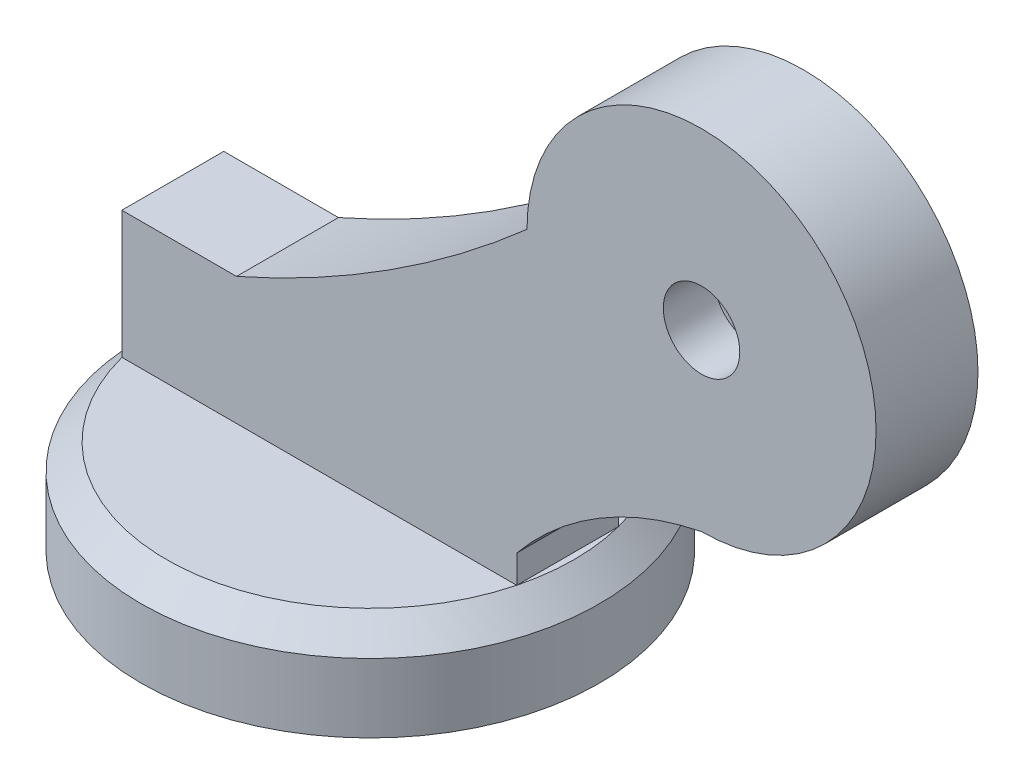
from build123d import *

# Parameters (mm, degrees)
SKETCH3_R                = 90
BOSS_EXTRUDE1_DEPTH      = 37
CHAMFER1_SIZE            = 10
SKETCH4_W                = 155
SKETCH4_H                = 40
BOSS_EXTRUDE2_DEPTH      = 50
CUT_EXTRUDE1_DEPTH       = 167.640331253
BOSS_EXTRUDE4_DEPTH      = 20
BOSS_EXTRUDE5_DEPTH      = 3.75
BOSS_EXTRUDE5_DRAFT      = 70
SKETCH8_R                = 40
BOSS_EXTRUDE6_DEPTH      = 1.5
BOSS_EXTRUDE8_START      = 3
SKETCH9_R                = 40
BOSS_EXTRUDE8_DEPTH      = 3
SKETCH14_R               = 40
BOSS_EXTRUDE9_DEPTH      = 18
BOSS_EXTRUDE9_TAPER      = 28
CUT_EXTRUDE4_REACH       = 346.265
SKETCH16_R               = 1.5
CUT_EXTRUDE5_DEPTH       = 5
CIRPATTERN1_COUNT        = 12
SKETCH17_R               = 22.5
CUT_EXTRUDE6_DEPTH       = 2
CUT_EXTRUDE6_DRAFT       = -45
BOSS_EXTRUDE10_DEPTH     = 4
BOSS_EXTRUDE10_DRAFT     = 20
CIRPATTERN2_COPY_1_DEPTH = 4
CIRPATTERN2_COPY_1_DRAFT = 20
CIRPATTERN2_COPY_2_DEPTH = 4
CIRPATTERN2_COPY_2_DRAFT = 20
CIRPATTERN2_COPY_3_DEPTH = 4
CIRPATTERN2_COPY_3_DRAFT = 20
SKETCH19_R               = 10.046864526
BOSS_EXTRUDE11_DEPTH     = 4
SKETCH20_R               = 5
CUT_EXTRUDE7_DEPTH       = 4
SKETCH21_R               = 15
CUT_EXTRUDE8_DEPTH       = 20
SKETCH22_R               = 15
CUT_EXTRUDE9_DEPTH       = 20


# Read off the part's stored shape, not the designer's step: Boss-Extrude5
with BuildPart() as part:
    # Sketch3 → Boss-Extrude1 (new body)
    with BuildSketch(Plane(origin=(0, 0, 0), x_dir=(1, 0, 0), z_dir=(0, 1, 0))):
        with Locations(Location((0, 0, 0), (0, 0, 270))):
            Circle(SKETCH3_R)
    extrude(amount=BOSS_EXTRUDE1_DEPTH)

    # Chamfer1
    chamfer1_edges = [part.edges().sort_by_distance(p)[0] for p in [
        (0, 37, -90),
    ]]
    chamfer(chamfer1_edges, length=CHAMFER1_SIZE)

    # Sketch4 → Boss-Extrude2 (add)
    with BuildSketch(Plane(origin=(0, 37, 0), x_dir=(1, 0, 0), z_dir=(0, 1, 0))):
        Rectangle(SKETCH4_W, SKETCH4_H)
    extrude(amount=BOSS_EXTRUDE2_DEPTH)

    # Sketch5 → Cut-Extrude1 (cut, through all)
    with BuildSketch(Plane(origin=(0, 0, -20), x_dir=(-1, 0, 0), z_dir=(0, 0, -1))):
        with BuildLine():
            Line((-77.5, 87), (32.5, 87))
            ThreePointArc((32.5, 87), (-18.551432041, 56.363013449), (-77.5, 48))
            Line((-77.5, 48), (-77.5, 87))
        make_face()
    extrude(amount=-CUT_EXTRUDE1_DEPTH, mode=Mode.SUBTRACT)


with BuildPart() as body_2:
    # Sketch6 → Boss-Extrude4 (new, symmetric)
    with BuildSketch(Plane.XY):
        with BuildLine():
            ThreePointArc((150, 91.5), (198.436814511, 208.436814511), (81.5, 160))
            ThreePointArc((81.5, 160), (27.32419397, 119.089614896), (-32.5, 87))
            ThreePointArc((-32.5, 87), (18.551432041, 56.363013449), (77.5, 48))
            ThreePointArc((77.5, 48), (109.960480223, 76.065866296), (150, 91.5))
        make_face()
    extrude(amount=BOSS_EXTRUDE4_DEPTH, both=True)


with BuildPart() as boss_extrude5_tool:
    # Boss-Extrude5 outline → Boss-Extrude5 (with draft: the straight prism first)
    with BuildSketch(Plane(origin=(0, 0, -23.75), x_dir=(-1, 0, 0), z_dir=(0, 0, -1))):
        with BuildLine():
            ThreePointArc((-72.55176842, 58.097049986), (-27.477837166, 64.25636131), (13.227009177, 84.57167275))
            ThreePointArc((13.227009177, 84.57167275), (-41.886113197, 116.333104692), (-91.973920822, 155.543515864))
            ThreePointArc((-91.973920822, 155.543515864), (-189.891312642, 202.374158297), (-149.050997815, 101.810778399))
            ThreePointArc((-149.050997815, 101.810778399), (-107.143478262, 86.355264818), (-72.55176842, 58.097049986))
        make_face()
    extrude(amount=-BOSS_EXTRUDE5_DEPTH)
    # Boss-Extrude5: the draft: its side faces are tilted about the plane it starts from
    boss_extrude5_sides = [boss_extrude5_tool.faces().sort_by_distance(p)[0] for p in [
        (189.891312643, 202.374158296, -21.875),
        (107.143478261, 86.355264818, -21.875),
        (27.477837166, 64.25636131, -21.875),
        (41.886113197, 116.333104692, -21.875),
    ]]
    draft(boss_extrude5_sides, Plane(origin=(0, 0, -23.75), x_dir=(-1, 0, 0), z_dir=(0, 0, -1)), BOSS_EXTRUDE5_DRAFT)


with BuildPart() as part_1:
    add(part.part)

    # Boss-Extrude5: add boss_extrude5_tool
    add(boss_extrude5_tool.part)

    add(body_2.part)  # Boss-Extrude5 merges body 2

    # Sketch8 → Boss-Extrude6 (add, symmetric)
    with BuildSketch(Plane(origin=(0, 0, -23.75), x_dir=(-1, 0, 0), z_dir=(0, 0, -1))):
        with Locations((-150, 160)):
            Circle(SKETCH8_R)
    extrude(amount=BOSS_EXTRUDE6_DEPTH, both=True)

    # Sketch9 → Boss-Extrude8 (add)
    with BuildSketch(Plane(origin=(0, 0, -25.25), x_dir=(-1, 0, 0), z_dir=(0, 0, -1)).offset(BOSS_EXTRUDE8_START)):
        with Locations((-150, 160)):
            Circle(SKETCH9_R)
    extrude(amount=-BOSS_EXTRUDE8_DEPTH)

    # Sketch14 → Boss-Extrude9 (add)
    with BuildSketch(Plane(origin=(0, 0, -28.25), x_dir=(-1, 0, 0), z_dir=(0, 0, -1))):
        with Locations((-150, 160)):
            Circle(SKETCH14_R)
    extrude(amount=BOSS_EXTRUDE9_DEPTH, taper=BOSS_EXTRUDE9_TAPER)

    # Cut-Extrude4: up to this face of the body (flat: up to its plane)
    cut_extrude4_end = Plane(part_1.part.faces().sort_by_distance((104.051669306, 126.132255553, -23.75))[0])
    # Sketch15 → Cut-Extrude4 (cut, up to the picked face)
    with BuildSketch(Plane(origin=(0, 0, -46.25), x_dir=(-1, 0, 0), z_dir=(0, 0, -1)), mode=Mode.PRIVATE) as cut_extrude4_sk1:
        with BuildLine():
            ThreePointArc((-147.878648769, 199.943708753), (-150, 200), (-152.121351231, 199.943708753))
            ThreePointArc((-152.121351231, 199.943708753), (-152.070318455, 194.961359195), (-150, 190.42923023))
            ThreePointArc((-150, 190.42923023), (-147.929681545, 194.961359195), (-147.878648769, 199.943708753))
        make_face()
    cut_extrude4_tool1 = split(extrude(cut_extrude4_sk1.sketch, amount=-CUT_EXTRUDE4_REACH, mode=Mode.PRIVATE), bisect_by=cut_extrude4_end, keep=Keep.BOTH, mode=Mode.PRIVATE)
    cut_extrude4 = cut_extrude4_tool1.solids().sort_by(Axis((150, 196.116659, -46.25), (0, 0, 1)))[0]
    add(cut_extrude4, mode=Mode.SUBTRACT)

    # Sketch16 → Cut-Extrude5 (cut)
    with BuildSketch(Plane(origin=(0, 0, -23.75), x_dir=(-1, 0, 0), z_dir=(0, 0, -1))):
        with Locations((-150, 195.186469492)):
            Circle(SKETCH16_R)
    cut_extrude5 = extrude(amount=-CUT_EXTRUDE5_DEPTH, mode=Mode.SUBTRACT)

    # CirPattern1: Cut-Extrude4, Cut-Extrude5 ×12 about axis
    cirpattern1_axis = Axis((150, 160, 0), (0, 0, 1))
    add([cut_extrude4.rotate(cirpattern1_axis, i * 360 / CIRPATTERN1_COUNT) for i in range(1, CIRPATTERN1_COUNT)], mode=Mode.SUBTRACT)
    add([cut_extrude5.rotate(cirpattern1_axis, i * 360 / CIRPATTERN1_COUNT) for i in range(1, CIRPATTERN1_COUNT)], mode=Mode.SUBTRACT)


with BuildPart() as cut_extrude6_tool:
    # Sketch17 → Cut-Extrude6 (with draft: the straight prism first)
    with BuildSketch(Plane(origin=(0, 0, -46.25), x_dir=(-1, 0, 0), z_dir=(0, 0, -1))):
        with Locations((-150, 160)):
            Circle(SKETCH17_R)
    extrude(amount=-CUT_EXTRUDE6_DEPTH)
    # Cut-Extrude6: the draft: its side faces are tilted about the plane it starts from
    cut_extrude6_sides = [cut_extrude6_tool.faces().sort_by_distance(p)[0] for p in [
        (172.5, 160, -45.25),
    ]]
    draft(cut_extrude6_sides, Plane(origin=(0, 0, -46.25), x_dir=(-1, 0, 0), z_dir=(0, 0, -1)), CUT_EXTRUDE6_DRAFT)


with BuildPart() as part_2:
    add(part_1.part)

    # Cut-Extrude6: cut by cut_extrude6_tool
    add(cut_extrude6_tool.part, mode=Mode.SUBTRACT)


with BuildPart() as boss_extrude10_tool:
    # Sketch18 → Boss-Extrude10 (with draft: the straight prism first)
    with BuildSketch(Plane(origin=(0, 0, -44.25), x_dir=(-1, 0, 0), z_dir=(0, 0, -1))):
        with BuildLine():
            ThreePointArc((-153, 167.95298686), (-150, 168.5), (-147, 167.95298686))
            Line((-147, 167.95298686), (-142.878841571, 178.153211909))
            ThreePointArc((-142.878841571, 178.153211909), (-150, 179.5), (-157.121158429, 178.153211909))
            Line((-157.121158429, 178.153211909), (-153, 167.95298686))
        make_face()
    extrude(amount=BOSS_EXTRUDE10_DEPTH)
    # Boss-Extrude10: the draft: its side faces are tilted about the plane it starts from
    boss_extrude10_sides = [boss_extrude10_tool.faces().sort_by_distance(p)[0] for p in [
        (150, 168.5, -46.25),
        (144.939420785, 173.053099385, -46.25),
        (150, 179.5, -46.25),
        (155.060579215, 173.053099385, -46.25),
    ]]
    draft(boss_extrude10_sides, Plane(origin=(0, 0, -44.25), x_dir=(-1, 0, 0), z_dir=(0, 0, -1)), BOSS_EXTRUDE10_DRAFT)


with BuildPart() as part_3:
    add(part_2.part)

    # Boss-Extrude10: add boss_extrude10_tool
    add(boss_extrude10_tool.part)


with BuildPart() as cirpattern2_copy_1_tool:
    # CirPattern2 copy 1 sketch → CirPattern2 copy 1 (with draft: the straight prism first)
    with BuildSketch(Plane(origin=(310, 10, -44.25), x_dir=(0, -1, 0), z_dir=(0, 0, -1))):
        with BuildLine():
            ThreePointArc((-153, 167.95298686), (-150, 168.5), (-147, 167.95298686))
            Line((-147, 167.95298686), (-142.878841571, 178.153211909))
            ThreePointArc((-142.878841571, 178.153211909), (-150, 179.5), (-157.121158429, 178.153211909))
            Line((-157.121158429, 178.153211909), (-153, 167.95298686))
        make_face()
    extrude(amount=CIRPATTERN2_COPY_1_DEPTH)
    # CirPattern2 copy 1: the draft: its side faces are tilted about the plane it starts from
    cirpattern2_copy_1_sides = [cirpattern2_copy_1_tool.faces().sort_by_distance(p)[0] for p in [
        (141.5, 160, -46.25),
        (136.946900615, 154.939420785, -46.25),
        (130.5, 160, -46.25),
        (136.946900615, 165.060579215, -46.25),
    ]]
    draft(cirpattern2_copy_1_sides, Plane(origin=(310, 10, -44.25), x_dir=(0, -1, 0), z_dir=(0, 0, -1)), CIRPATTERN2_COPY_1_DRAFT)


with BuildPart() as part_4:
    add(part_3.part)

    # CirPattern2 copy 1: add cirpattern2_copy_1_tool
    add(cirpattern2_copy_1_tool.part)


with BuildPart() as cirpattern2_copy_2_tool:
    # CirPattern2 copy 2 sketch → CirPattern2 copy 2 (with draft: the straight prism first)
    with BuildSketch(Plane(origin=(300, 320, -44.25), x_dir=(1, 0, 0), z_dir=(0, 0, -1))):
        with BuildLine():
            ThreePointArc((-153, 167.95298686), (-150, 168.5), (-147, 167.95298686))
            Line((-147, 167.95298686), (-142.878841571, 178.153211909))
            ThreePointArc((-142.878841571, 178.153211909), (-150, 179.5), (-157.121158429, 178.153211909))
            Line((-157.121158429, 178.153211909), (-153, 167.95298686))
        make_face()
    extrude(amount=CIRPATTERN2_COPY_2_DEPTH)
    # CirPattern2 copy 2: the draft: its side faces are tilted about the plane it starts from
    cirpattern2_copy_2_sides = [cirpattern2_copy_2_tool.faces().sort_by_distance(p)[0] for p in [
        (150, 151.5, -46.25),
        (155.060579215, 146.946900615, -46.25),
        (150, 140.5, -46.25),
        (144.939420785, 146.946900615, -46.25),
    ]]
    draft(cirpattern2_copy_2_sides, Plane(origin=(300, 320, -44.25), x_dir=(1, 0, 0), z_dir=(0, 0, -1)), CIRPATTERN2_COPY_2_DRAFT)


with BuildPart() as part_5:
    add(part_4.part)

    # CirPattern2 copy 2: add cirpattern2_copy_2_tool
    add(cirpattern2_copy_2_tool.part)


with BuildPart() as cirpattern2_copy_3_tool:
    # CirPattern2 copy 3 sketch → CirPattern2 copy 3 (with draft: the straight prism first)
    with BuildSketch(Plane(origin=(-10, 310, -44.25), x_dir=(0, 1, 0), z_dir=(0, 0, -1))):
        with BuildLine():
            ThreePointArc((-153, 167.95298686), (-150, 168.5), (-147, 167.95298686))
            Line((-147, 167.95298686), (-142.878841571, 178.153211909))
            ThreePointArc((-142.878841571, 178.153211909), (-150, 179.5), (-157.121158429, 178.153211909))
            Line((-157.121158429, 178.153211909), (-153, 167.95298686))
        make_face()
    extrude(amount=CIRPATTERN2_COPY_3_DEPTH)
    # CirPattern2 copy 3: the draft: its side faces are tilted about the plane it starts from
    cirpattern2_copy_3_sides = [cirpattern2_copy_3_tool.faces().sort_by_distance(p)[0] for p in [
        (158.5, 160, -46.25),
        (163.053099385, 165.060579215, -46.25),
        (169.5, 160, -46.25),
        (163.053099385, 154.939420785, -46.25),
    ]]
    draft(cirpattern2_copy_3_sides, Plane(origin=(-10, 310, -44.25), x_dir=(0, 1, 0), z_dir=(0, 0, -1)), CIRPATTERN2_COPY_3_DRAFT)


with BuildPart() as part_6:
    add(part_5.part)

    # CirPattern2 copy 3: add cirpattern2_copy_3_tool
    add(cirpattern2_copy_3_tool.part)

    # Sketch19 → Boss-Extrude11 (add)
    with BuildSketch(Plane(origin=(0, 0, -44.25), x_dir=(-1, 0, 0), z_dir=(0, 0, -1))):
        with Locations((-150, 160)):
            Circle(SKETCH19_R)
    extrude(amount=BOSS_EXTRUDE11_DEPTH)

    # Sketch20 → Cut-Extrude7 (cut)
    with BuildSketch(Plane(origin=(0, 0, -48.25), x_dir=(-1, 0, 0), z_dir=(0, 0, -1))):
        with Locations((-150, 160)):
            Circle(SKETCH20_R)
    extrude(amount=-CUT_EXTRUDE7_DEPTH, mode=Mode.SUBTRACT)

    # Sketch21 → Cut-Extrude8 (cut)
    with BuildSketch(Plane.XY.offset(20)):
        with Locations((150, 160)):
            Circle(SKETCH21_R)
    extrude(amount=-CUT_EXTRUDE8_DEPTH, mode=Mode.SUBTRACT)

    # Sketch22 → Cut-Extrude9 (cut)
    with BuildSketch(Plane(origin=(0, 0, 0), x_dir=(-1, 0, 0), z_dir=(0, -1, 0))):
        with Locations(Location((0, 0, 0), (0, 0, 90))):
            Circle(SKETCH22_R)
    extrude(amount=-CUT_EXTRUDE9_DEPTH, mode=Mode.SUBTRACT)


solid = part_6.part
